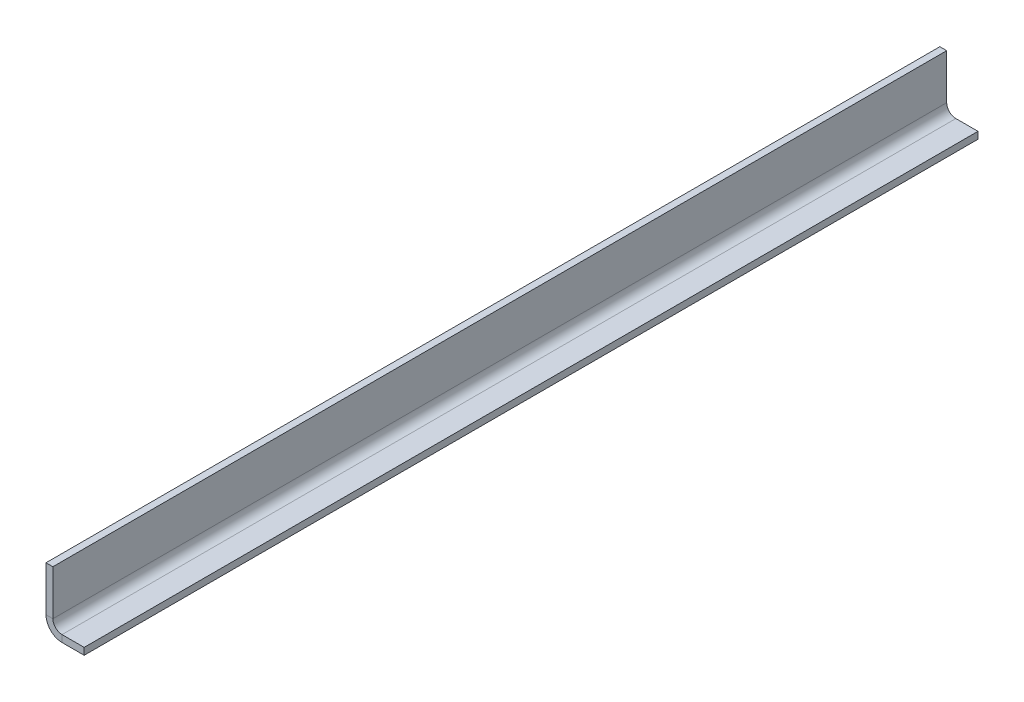
from build123d import *

# Parameters (mm, degrees)
BOSS_EXTRUDE1_DEPTH    = 195
CONVERT_SOLID1_DEPTH   = 195
CONVERT_SOLID1_2_DEPTH = 195


# Read off the part's stored shape, not the designer's step: Convert-Solid1
with BuildPart() as part:
    # Sketch1 → Boss-Extrude1 (new body)
    with BuildSketch(Plane.XY):
        Polygon((0, 15), (0, 0), (10, 0), (10, 3.175), (3.175, 3.175), (3.175, 15), align=None)
    extrude(amount=BOSS_EXTRUDE1_DEPTH)

    # Convert-Solid1 outline → Convert-Solid1 (cut)
    with BuildSketch(Plane.XY):
        with BuildLine():
            Line((1.675, 5.175), (1.675, 15))
            Line((1.675, 15), (0, 15))
            Line((0, 15), (0, 0))
            Line((0, 0), (10, 0))
            Line((10, 0), (10, 1.675))
            Line((10, 1.675), (5.175, 1.675))
            ThreePointArc((5.175, 1.675), (2.700126266, 2.700126266), (1.675, 5.175))
        make_face()
    extrude(amount=CONVERT_SOLID1_DEPTH, mode=Mode.SUBTRACT)

    # Convert-Solid1 2 outline → Convert-Solid1 2 (add)
    with BuildSketch(Plane.XY):
        with BuildLine():
            ThreePointArc((5.175, 3.175), (3.760786438, 3.760786438), (3.175, 5.175))
            Line((3.175, 5.175), (3.175, 3.175))
            Line((3.175, 3.175), (5.175, 3.175))
        make_face()
    extrude(amount=CONVERT_SOLID1_2_DEPTH)


solid = part.part
